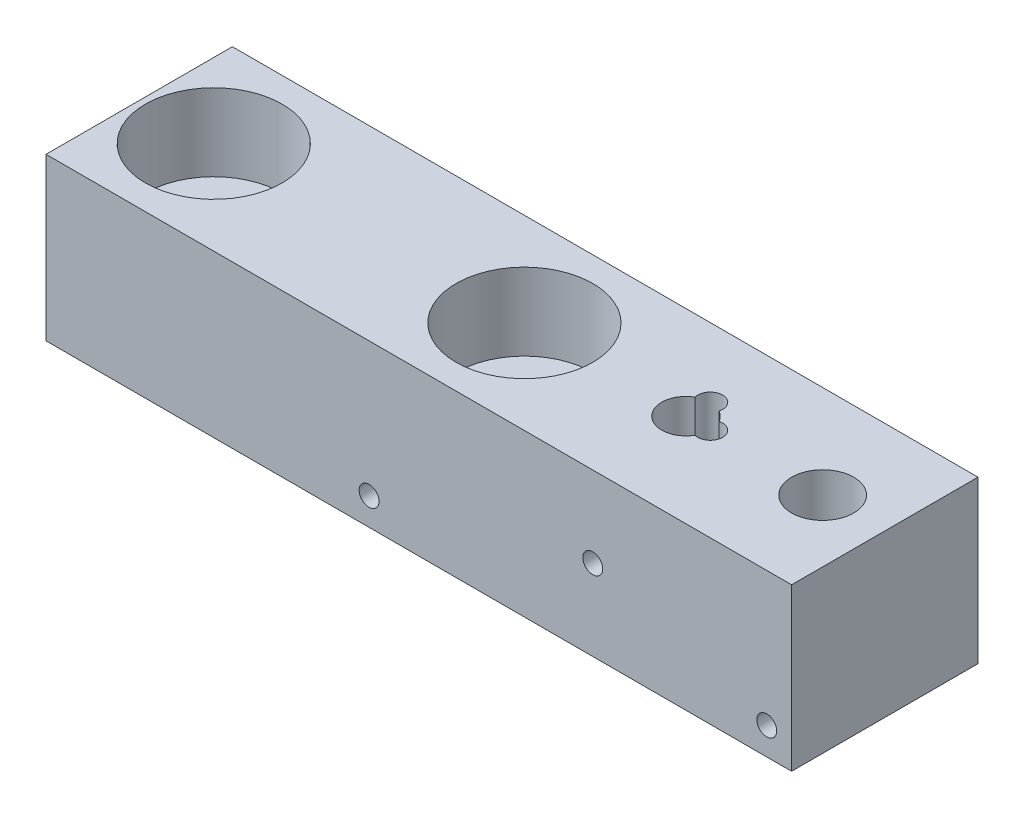
from build123d import *

# Parameters (mm, degrees)
SKETCH1_W                 = 60
SKETCH1_H                 = 15
BOSS_EXTRUDE1_DEPTH       = 13
M2X0_4_TAPPED_HOLE1_D     = 1.6
CUT_EXTRUDE1_DEPTH        = 46.591613279
M6X1_0_TAPPED_HOLE1_D     = 5
M6X1_0_TAPPED_HOLE1_DEPTH = 10
M6X1_0_TAPPED_HOLE1_TIP   = 1.502151548
SKETCH15_R                = 3
CUT_EXTRUDE2_DEPTH        = 46.591613308
SKETCH16_R                = 5.5
CUT_EXTRUDE3_DEPTH        = 6.2


# Read off the part's stored shape, not the designer's step: M2x0.4 Tapped Hole2
with BuildPart() as part:
    # Sketch1 → Boss-Extrude1 (new body)
    with BuildSketch(Plane(origin=(0, 0, 0), x_dir=(1, 0, 0), z_dir=(0, 1, 0))):
        with Locations((12.93814433, 0.618556701)):
            Rectangle(SKETCH1_W, SKETCH1_H)
    extrude(amount=BOSS_EXTRUDE1_DEPTH)

    # M2x0.4 Tapped Hole1 (through all)
    with Locations(Plane(origin=(0, 0, -8.118556701), x_dir=(-1, 0, 0), z_dir=(0, 0, -1))):
        with Locations((-40.93814433, 2.2), (-8.93814433, 2.2)):
            Hole(M2X0_4_TAPPED_HOLE1_D / 2)

    # Sketch5 → Cut-Extrude1 (cut, through all)
    with BuildSketch(Plane(origin=(0, 13, 0), x_dir=(1, 0, 0), z_dir=(0, 1, 0))):
        with BuildLine():
            ThreePointArc((28.631734073, 1.585124743), (28.317002553, 1.997414924), (27.904712372, 2.312146445))
            ThreePointArc((27.904712372, 2.312146445), (26.93814433, 3.568556701), (25.971576288, 2.312146445))
            ThreePointArc((25.971576288, 2.312146445), (25.559286107, -0.760301522), (28.631734073, -0.348011341))
            ThreePointArc((28.631734073, -0.348011341), (29.88814433, 0.618556701), (28.631734073, 1.585124743))
        make_face()
    extrude(amount=-CUT_EXTRUDE1_DEPTH, mode=Mode.SUBTRACT)

    # M2x0.4 Tapped Hole2 outline → M2x0.4 Tapped Hole2 (revolve, cut)
    with BuildSketch(Plane(origin=(26.93814433, 6.5, 0), x_dir=(1, 0, 0), z_dir=(0, -1, 0))):
        Polygon((0, 1.227710243), (0.627359351, 1.227710243), (0.8, 1.331443299), (0.8, 6.881443299), (0, 6.881443299), align=None)
    revolve(axis=Axis((26.93814433, 6.5, 0), (0, 0, 1)), mode=Mode.SUBTRACT)

    # M6x1.0 Tapped Hole1
    with Locations(Plane(origin=(0, 13, 0), x_dir=(1, 0, 0), z_dir=(0, 1, 0))):
        with Locations((37.93814433, 0.618556701)):
            Hole(M6X1_0_TAPPED_HOLE1_D / 2, depth=M6X1_0_TAPPED_HOLE1_DEPTH)
            with Locations((0, 0, -(M6X1_0_TAPPED_HOLE1_DEPTH + M6X1_0_TAPPED_HOLE1_TIP / 2))):  # 118° drill point
                Cone(0, M6X1_0_TAPPED_HOLE1_D / 2, M6X1_0_TAPPED_HOLE1_TIP, mode=Mode.SUBTRACT)

    # Sketch15 → Cut-Extrude2 (cut, through all)
    with BuildSketch(Plane(origin=(0, 13, 0), x_dir=(1, 0, 0), z_dir=(0, 1, 0))):
        with Locations(Location((-11.06185567, 0.618556701, 0), (0, 0, 270))):
            Circle(SKETCH15_R)
        with Locations(Location((13.93814433, 0.618556701, 0), (0, 0, 270))):
            Circle(SKETCH15_R)
    extrude(amount=-CUT_EXTRUDE2_DEPTH, mode=Mode.SUBTRACT)

    # Sketch16 → Cut-Extrude3 (cut)
    with BuildSketch(Plane(origin=(0, 13, 0), x_dir=(1, 0, 0), z_dir=(0, 1, 0))):
        with Locations(Location((-11.06185567, 0.618556701, 0), (0, 0, 270))):
            Circle(SKETCH16_R)
        with Locations(Location((13.93814433, 0.618556701, 0), (0, 0, 270))):
            Circle(SKETCH16_R)
    extrude(amount=-CUT_EXTRUDE3_DEPTH, mode=Mode.SUBTRACT)


solid = part.part
